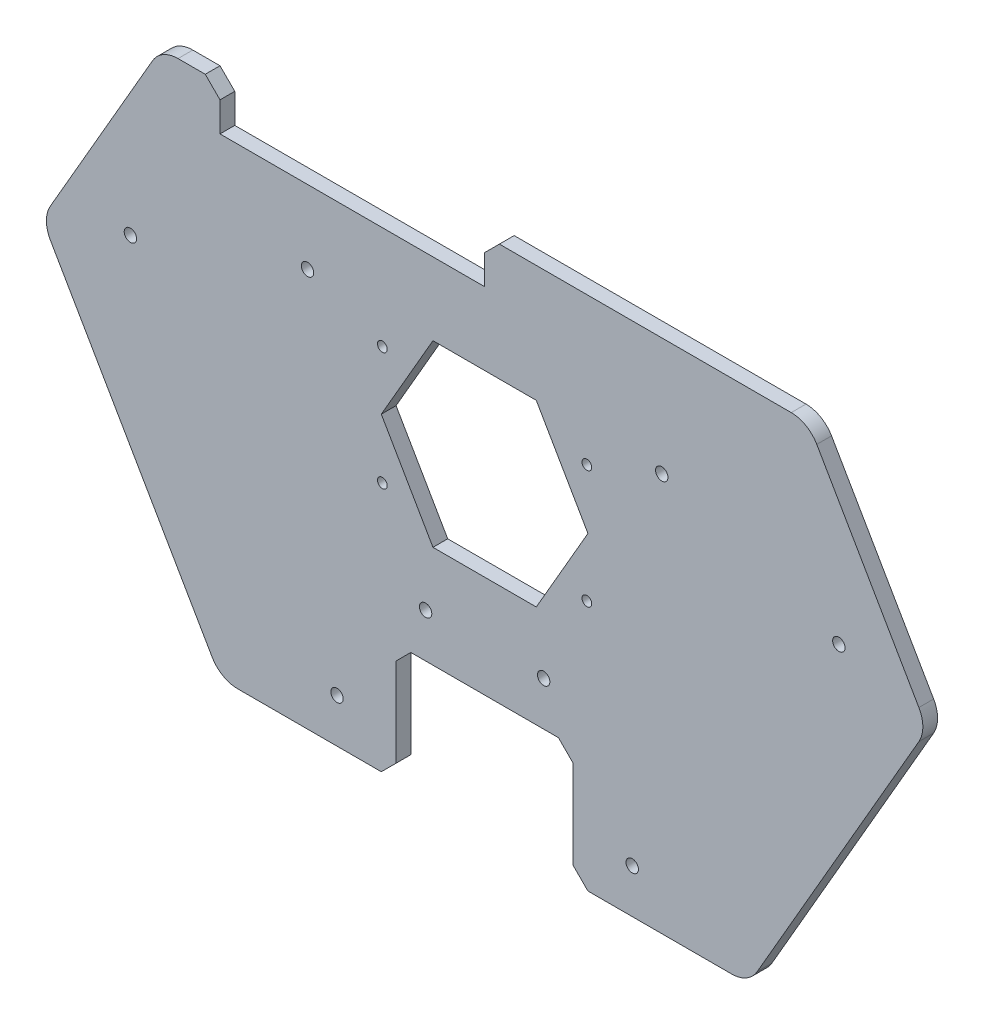
from build123d import *

# Parameters (mm, degrees)
EXTRUDE_1_DEPTH          = 5
CUT_EXTRUDE_2_DEPTH      = 199.494332413
CUT_EXTRUDE_2_DEPTH_BACK = 199.494332413
CUT_EXTRUDE_3_REACH      = 200.494
CHAMFER_1_SIZE           = 5
CUT_EXTRUDE_6_DEPTH      = 199.494332413
CUT_EXTRUDE_6_DEPTH_BACK = 199.494332413
CHAMFER_2_SIZE           = 5
CUT_EXTRUDE_7_REACH      = 185.111
SKETCH_6_R               = 2.1
FILLET_1_R               = 10
M4X0_7_1_D               = 3.3
M4X0_7_1_DEPTH           = 11.5
M4X0_7_1_TIP             = 0.991420021


with BuildPart() as part:
    # 草圖1 → 填料-伸長1 (new body)
    with BuildSketch(Plane.XY):
        Polygon((150, 0), (75, 129.903810568), (-75, 129.903810568), (-150, 0), (-75, -129.903810568), (75, -129.903810568), align=None)
    extrude(amount=EXTRUDE_1_DEPTH)

    # 草圖3 → 除料-伸長2 (cut, two sides: drawn at the far end of the back side and taken through both)
    with BuildSketch(Plane.XY.offset(5).offset(-CUT_EXTRUDE_2_DEPTH_BACK)):
        Polygon((-774.886138932, 69.903810568), (-109.641016151, 69.903810568), (-89.641016151, 69.903810568), (-89.641016151, 54.903810568), (0, 54.903810568), (0, 69.903810568), (109.641016151, 69.903810568), (774.886138932, 69.903810568), (774.886138932, 1400.394056128), (-774.886138932, 1400.394056128), align=None)
    extrude(amount=CUT_EXTRUDE_2_DEPTH + CUT_EXTRUDE_2_DEPTH_BACK, mode=Mode.SUBTRACT)

    # 草圖4 → 除料-伸長3 (cut, up to next)
    with BuildSketch(Plane.XY.offset(5), mode=Mode.PRIVATE) as cut_extrude_3_sk1:
        Polygon((35, 0), (17.5, 30.310889132), (-17.5, 30.310889132), (-35, 0), (-17.5, -30.310889132), (17.5, -30.310889132), align=None)
    cut_extrude_3_tool1 = extrude(cut_extrude_3_sk1.sketch, amount=-CUT_EXTRUDE_3_REACH, mode=Mode.PRIVATE) & part.part
    add(cut_extrude_3_tool1.solids().sort_by_distance((0, 0, 5))[0], mode=Mode.SUBTRACT)

    # 導角1
    chamfer_1_edges = [part.edges().sort_by_distance(p)[0] for p in [
        (0, 69.903810568, 2.5),
        (-89.641016151, 69.903810568, 2.5),
    ]]
    chamfer(chamfer_1_edges, length=CHAMFER_1_SIZE)

    # 草圖5 → 除料-伸長6 (cut, two sides: drawn at the far end of the back side and taken through both)
    with BuildSketch(Plane.XY.offset(5).offset(-CUT_EXTRUDE_6_DEPTH_BACK)):
        Polygon((-692.345987228, -104.903810568), (-89.43375673, -104.903810568), (-30, -104.903810568), (-30, -64.903810568), (30, -64.903810568), (30, -104.903810568), (89.43375673, -104.903810568), (692.345987228, -104.903810568), (692.345987228, -1310.728271565), (-692.345987228, -1310.728271565), align=None)
    extrude(amount=CUT_EXTRUDE_6_DEPTH + CUT_EXTRUDE_6_DEPTH_BACK, mode=Mode.SUBTRACT)

    # 導角2
    chamfer_2_edges = [part.edges().sort_by_distance(p)[0] for p in [
        (30, -104.903810568, 2.5),
        (30, -64.903810568, 2.5),
        (-30, -64.903810568, 2.5),
        (-30, -104.903810568, 2.5),
    ]]
    chamfer(chamfer_2_edges, length=CHAMFER_2_SIZE)

    # 草圖6 → 除料-伸長7 (cut, up to next)
    with BuildSketch(Plane.XY.offset(5), mode=Mode.PRIVATE) as cut_extrude_7_sk1:
        with Locations((-50, -90)):
            Circle(SKETCH_6_R)
    cut_extrude_7_tool1 = extrude(cut_extrude_7_sk1.sketch, amount=-CUT_EXTRUDE_7_REACH, mode=Mode.PRIVATE) & part.part
    # 草圖6 → 除料-伸長7 (cut, up to next)
    with BuildSketch(Plane.XY.offset(5), mode=Mode.PRIVATE) as cut_extrude_7_sk2:
        with Locations((-120, 10)):
            Circle(SKETCH_6_R)
    cut_extrude_7_tool2 = extrude(cut_extrude_7_sk2.sketch, amount=-CUT_EXTRUDE_7_REACH, mode=Mode.PRIVATE) & part.part
    # 草圖6 → 除料-伸長7 (cut, up to next)
    with BuildSketch(Plane.XY.offset(5), mode=Mode.PRIVATE) as cut_extrude_7_sk3:
        with Locations((-60, 30)):
            Circle(SKETCH_6_R)
    cut_extrude_7_tool3 = extrude(cut_extrude_7_sk3.sketch, amount=-CUT_EXTRUDE_7_REACH, mode=Mode.PRIVATE) & part.part
    # 草圖6 → 除料-伸長7 (cut, up to next)
    with BuildSketch(Plane.XY.offset(5), mode=Mode.PRIVATE) as cut_extrude_7_sk4:
        with Locations((-20, -50)):
            Circle(SKETCH_6_R)
    cut_extrude_7_tool4 = extrude(cut_extrude_7_sk4.sketch, amount=-CUT_EXTRUDE_7_REACH, mode=Mode.PRIVATE) & part.part
    cut_extrude_7_1 = cut_extrude_7_tool1.solids().sort_by_distance((-50, -90, 5))[0]
    add(cut_extrude_7_1, mode=Mode.SUBTRACT)
    cut_extrude_7_2 = cut_extrude_7_tool2.solids().sort_by_distance((-120, 10, 5))[0]
    add(cut_extrude_7_2, mode=Mode.SUBTRACT)
    cut_extrude_7_3 = cut_extrude_7_tool3.solids().sort_by_distance((-60, 30, 5))[0]
    add(cut_extrude_7_3, mode=Mode.SUBTRACT)
    cut_extrude_7_4 = cut_extrude_7_tool4.solids().sort_by_distance((-20, -50, 5))[0]
    add(cut_extrude_7_4, mode=Mode.SUBTRACT)
    cut_extrude_7 = cut_extrude_7_1 + cut_extrude_7_2 + cut_extrude_7_3 + cut_extrude_7_4  # 除料-伸長7 as one shape, for the pattern or mirror that repeats it

    # 鏡射1: 除料-伸長7 across plane
    add(cut_extrude_7.mirror(Plane(origin=(0, 0, 0), x_dir=(0, 0, 1), z_dir=(1, 0, 0))), mode=Mode.SUBTRACT)

    # 圓角1
    fillet_1_edges = [part.edges().sort_by_distance(p)[0] for p in [
        (109.641016151, 69.903810568, 2.5),
        (150, 0, 2.5),
        (89.43375673, -104.903810568, 2.5),
        (-89.43375673, -104.903810568, 2.5),
        (-150, 0, 2.5),
        (-109.641016151, 69.903810568, 2.5),
    ]]
    fillet(fillet_1_edges, radius=FILLET_1_R)

    # M4x0.7 螺紋孔1
    with Locations(Plane.XY.offset(5)):
        with Locations((-34.641016151, 20), (34.641016151, 20), (34.641016151, -20), (-34.641016151, -20)):
            Hole(M4X0_7_1_D / 2, depth=M4X0_7_1_DEPTH)
            with Locations((0, 0, -(M4X0_7_1_DEPTH + M4X0_7_1_TIP / 2))):  # 118° drill point
                Cone(0, M4X0_7_1_D / 2, M4X0_7_1_TIP, mode=Mode.SUBTRACT)


solid = part.part
